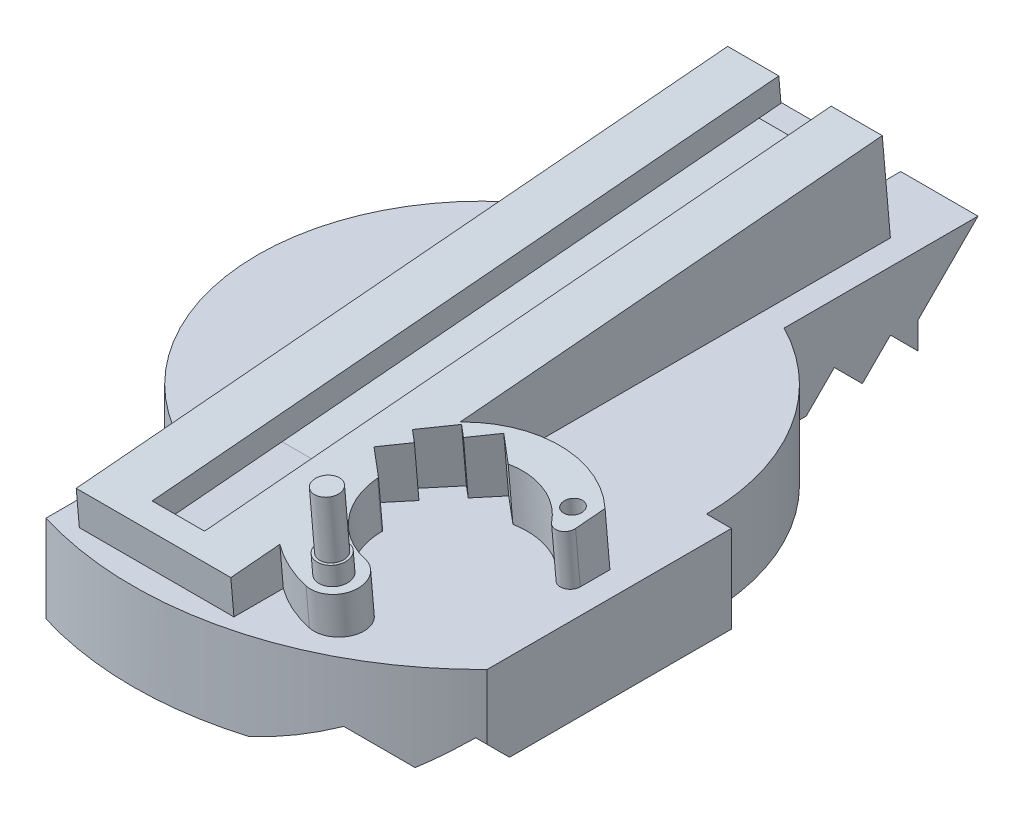
from build123d import *

# Parameters (mm, degrees)
ESQUISSE1_W                     = 100
ESQUISSE1_H                     = 140
ESQUISSE1_R                     = 45
BOSS_EXTRU_1_DEPTH              = 12.5
ESQUISSE3_W                     = 100
ESQUISSE3_H                     = 140
BOSS_EXTRU_2_DEPTH              = 5
BOSS_EXTRU_6_REACH              = 196.163
ESQUISSE15_W                    = 31
ESQUISSE15_H                    = 96
BOSS_EXTRU_3_DEPTH              = 60
BOSS_EXTRU_3_DIRECTION_2_REACH  = 94.681
ESQUISSE7_W                     = 31
ESQUISSE7_H                     = 7.615352471
BOSS_EXTRU_4_DEPTH              = 5
ENL_V_MAT_EXTRU_3_DEPTH         = 126.114159057
CHANFREIN1_SIZE                 = 13
ESQUISSE18_W                    = 5.5
ESQUISSE18_H                    = 3
ENL_V_MAT_EXTRU_5_DEPTH         = 10
CHANFREIN2_SIZE                 = 2
ENL_V_MAT_EXTRU_1_DEPTH         = 89.006477678
ENL_V_MAT_EXTRU_1_DEPTH_BACK    = 89.006477678
ENL_V_MAT_EXTRU_2_DEPTH         = 94.282464894
ENL_V_MAT_EXTRU_2_DEPTH_BACK    = 94.282464894
ESQUISSE17_W                    = 6.4
ESQUISSE17_H                    = 3.4
ENL_V_MAT_EXTRU_4_DEPTH         = 5
CHANFREIN3_SIZE                 = 0.5
ESQUISSE19_OUTSIDE_W            = 131.598
ESQUISSE19_OUTSIDE_H            = 176.598
ENL_V_MAT_EXTRU_6_DEPTH         = 89.006477678
ENL_V_MAT_EXTRU_7_DEPTH         = 10
ENL_V_MAT_EXTRU_7_DEPTH_BACK    = 88.26725067
BOSS_EXTRU_7_REACH              = 92.836
ESQUISSE22_R                    = 1.9
ENL_V_MAT_EXTRU_8_DEPTH         = 10
ESQUISSE23_R                    = 3
BOSS_EXTRU_8_DEPTH              = 3.9
ESQUISSE24_R                    = 2.5
BOSS_EXTRU_9_DEPTH              = 12
BOSS_EXTRU_10_REACH             = 97.553
BOSS_EXTRU_10_DIRECTION_2_REACH = 97.553
ENL_V_MAT_EXTRU_10_DEPTH        = 5
ENL_V_MAT_EXTRU_10_DEPTH_BACK   = 5
ENL_V_MAT_EXTRU_11_REACH        = 153.593
ESQUISSE27_W                    = 2
ESQUISSE27_H                    = 15.461719317
CHANFREIN4_SIZE                 = 1


# Some blends are built 0.0001 mm under size
with BuildPart() as part:
    # Esquisse1 → Boss.-Extru.1 (new body)
    with BuildSketch(Plane(origin=(0, 0, 0), x_dir=(1, 0, 0), z_dir=(0, 1, 0))):
        Rectangle(ESQUISSE1_W, ESQUISSE1_H)
        with Locations(Location((0, 0, 0), (0, 0, 270))):
            Circle(ESQUISSE1_R, mode=Mode.SUBTRACT)
    extrude(amount=BOSS_EXTRU_1_DEPTH)

    # Esquisse3 → Boss.-Extru.2 (add)
    with BuildSketch(Plane(origin=(0, 12.5, 0), x_dir=(1, 0, 0), z_dir=(0, 1, 0))):
        Rectangle(ESQUISSE3_W, ESQUISSE3_H)
    extrude(amount=BOSS_EXTRU_2_DEPTH)

    # Boss.-Extru.6: up to this face of the body (flat: up to its plane)
    boss_extru_6_end = Plane(part.part.faces().sort_by_distance((0, 17.5, 0))[0])
    # Esquisse15 → Boss.-Extru.6 (add, up to the picked face)
    with BuildSketch(Plane(origin=(0, 9.857399497, 117.355323483), x_dir=(1, 0, 0), z_dir=(0, 0.9961946980917459, 0.08715574274765504)), mode=Mode.PRIVATE) as boss_extru_6_sk1:
        with Locations((0, 135.689006627)):
            Rectangle(ESQUISSE15_W, ESQUISSE15_H)
    boss_extru_6_tool1 = split(extrude(boss_extru_6_sk1.sketch, amount=-BOSS_EXTRU_6_REACH, mode=Mode.PRIVATE), bisect_by=boss_extru_6_end, keep=Keep.BOTH, mode=Mode.PRIVATE)
    add(boss_extru_6_tool1.solids().sort_by(Axis((0, 21.683476, -17.817346), (0, -0.9961946980917459, -0.08715574274765504)))[0])

    # Esquisse6 → Boss.-Extru.3 (add)
    with BuildSketch(Plane(origin=(0, -4.423503026, -1.91805798), x_dir=(1, 0, 0), z_dir=(0, -0.08715574274765504, 0.9961946980917459))):
        Polygon((15.5, 24.621919528), (10.5, 24.621919528), (5.25, 29.871919528), (5.25, 34.871919528), (15.5, 34.871919528), align=None)
        Polygon((-5.25, 29.871919528), (-5.25, 34.871919528), (-15.5, 34.871919528), (-15.5, 24.621919528), (-10.5, 24.621919528), align=None)
    extrude(amount=BOSS_EXTRU_3_DEPTH)

    # Boss.-Extru.3 direction 2: up to this face of the body (flat: up to its plane)
    boss_extru_3_direction_2_end = Plane(part.part.faces().sort_by_distance((0, 21.683475652, -66.00069771))[0])
    # Esquisse6 → Boss.-Extru.3 direction 2 (add, up to the picked face)
    with BuildSketch(Plane(origin=(0, -4.423503026, -1.91805798), x_dir=(1, 0, 0), z_dir=(0, -0.08715574274765504, 0.9961946980917459)), mode=Mode.PRIVATE) as boss_extru_3_direction_2_sk1:
        Polygon((15.5, 24.621919528), (10.5, 24.621919528), (5.25, 29.871919528), (5.25, 34.871919528), (15.5, 34.871919528), align=None)
    boss_extru_3_direction_2_tool1 = split(extrude(boss_extru_3_direction_2_sk1.sketch, amount=-BOSS_EXTRU_3_DIRECTION_2_REACH, mode=Mode.PRIVATE), bisect_by=boss_extru_3_direction_2_end, keep=Keep.BOTH, mode=Mode.PRIVATE)
    # Esquisse6 → Boss.-Extru.3 direction 2 (add, up to the picked face)
    with BuildSketch(Plane(origin=(0, -4.423503026, -1.91805798), x_dir=(1, 0, 0), z_dir=(0, -0.08715574274765504, 0.9961946980917459)), mode=Mode.PRIVATE) as boss_extru_3_direction_2_sk2:
        Polygon((-5.25, 29.871919528), (-5.25, 34.871919528), (-15.5, 34.871919528), (-15.5, 24.621919528), (-10.5, 24.621919528), align=None)
    boss_extru_3_direction_2_tool2 = split(extrude(boss_extru_3_direction_2_sk2.sketch, amount=-BOSS_EXTRU_3_DIRECTION_2_REACH, mode=Mode.PRIVATE), bisect_by=boss_extru_3_direction_2_end, keep=Keep.BOTH, mode=Mode.PRIVATE)
    add(boss_extru_3_direction_2_tool1.solids().sort_by(Axis((10.884543, 25.717824, 0.718966), (0, 0.08715574274765504, -0.9961946980917459)))[0])
    add(boss_extru_3_direction_2_tool2.solids().sort_by(Axis((-10.884543, 25.717824, 0.718966), (0, 0.08715574274765504, -0.9961946980917459)))[0])

    # Esquisse7 → Boss.-Extru.4 (add)
    with BuildSketch(Plane(origin=(0, -5.096412404, 58.252260331), x_dir=(1, 0, 0), z_dir=(0, -0.08715574274765515, 0.9961946980917459))):
        with Locations((0, 26.490403264)):
            Rectangle(ESQUISSE7_W, ESQUISSE7_H)
    extrude(amount=BOSS_EXTRU_4_DEPTH)

    # Esquisse16 → Enlèv. mat.-Extru.3 (cut)
    with BuildSketch(Plane(origin=(0, 5.8951608, -67.381996276), x_dir=(-1, 0, 0), z_dir=(0, 0.0871557427476551, -0.9961946980917459))):
        Polygon((-10.5, 20.048079499), (-5.25, 25.298079499), (-5.25, 30.298079499), (5.25, 30.298079499), (5.25, 25.298079499), (10.5, 20.048079499), align=None)
    extrude(amount=-ENL_V_MAT_EXTRU_3_DEPTH, mode=Mode.SUBTRACT)

    # Chanfrein1
    # the kernel refuses this chamfer: 13 mm, written as the material it adds along each edge
    with BuildSketch(Plane(origin=(0, 12.5, 0), x_dir=(0, 0, 1), z_dir=(-1, 0, 0))) as chanfrein1_piece_1_section:
        Polygon((45, -CHANFREIN1_SIZE), (45 - CHANFREIN1_SIZE, 0), (45, 0), align=None)
    chanfrein1_piece_1 = revolve(axis=Axis((0, 12.5, 0), (0, 1, 0)), mode=Mode.PRIVATE)
    chanfrein1_piece_1 = split(chanfrein1_piece_1, bisect_by=Plane(origin=(0, 0, -38.269047207), z_dir=(0, 1, 0)), keep=Keep.TOP, mode=Mode.PRIVATE)
    add(chanfrein1_piece_1)

    # Esquisse18 → Enlèv. mat.-Extru.5 (cut)
    with BuildSketch(Plane(origin=(0, 12.5, 0), x_dir=(-1, 0, 0), z_dir=(0, -1, 0))):
        Rectangle(ESQUISSE18_W, ESQUISSE18_H)
    extrude(amount=-ENL_V_MAT_EXTRU_5_DEPTH, mode=Mode.SUBTRACT)

    # Chanfrein2
    chanfrein2_edges = [part.edges().sort_by_distance(p)[0] for p in [
        (0, 12.5, -1.5),
        (0, 12.5, 1.5),
    ]]
    chamfer(chanfrein2_edges, length=CHANFREIN2_SIZE)

    # Esquisse12 → Enlèv. mat.-Extru.1 (cut, two sides: drawn at the far end of the back side and taken through both)
    with BuildSketch(Plane(origin=(0, 17.5, 0), x_dir=(1, 0, 0), z_dir=(0, 1, 0)).offset(-ENL_V_MAT_EXTRU_1_DEPTH_BACK)):
        with BuildLine():
            Line((-50, 70), (-50, -70))
            Line((-50, -70), (-20.5, -70))
            Line((-20.5, -70), (-20.5, -40.059330998))
            ThreePointArc((-20.5, -40.059330998), (-45, 0), (-20.5, 40.059330998))
            Line((-20.5, 40.059330998), (-20.5, 70))
            Line((-20.5, 70), (-50, 70))
        make_face()
        with BuildLine():
            Line((50, 70), (20.5, 70))
            Line((20.5, 70), (20.5, 40.059330998))
            ThreePointArc((20.5, 40.059330998), (38.389451676, 23.478713764), (45, 0))
            Line((45, 0), (50, 0))
            Line((50, 0), (50, 70))
        make_face()
    extrude(amount=ENL_V_MAT_EXTRU_1_DEPTH + ENL_V_MAT_EXTRU_1_DEPTH_BACK, mode=Mode.SUBTRACT)

    # Esquisse13 → Enlèv. mat.-Extru.2 (cut, two sides: drawn at the far end of the back side and taken through both)
    with BuildSketch(Plane(origin=(0, 0, 0), x_dir=(0, 0, -1), z_dir=(1, 0, 0)).offset(-ENL_V_MAT_EXTRU_2_DEPTH_BACK)):
        Polygon((-55.75, 0), (-50.125, 5.625), (-44.5, 0), align=None)
        Polygon((-67, 0), (-61.375, 5.625), (-55.75, 0), align=None)
        Polygon((55.75, 0), (50.125, 5.625), (44.5, 0), align=None)
        Polygon((67, 0), (55.75, 0), (61.375, 5.625), align=None)
    extrude(amount=ENL_V_MAT_EXTRU_2_DEPTH + ENL_V_MAT_EXTRU_2_DEPTH_BACK, mode=Mode.SUBTRACT)

    # Esquisse17 → Enlèv. mat.-Extru.4 (cut)
    with BuildSketch(Plane(origin=(0, 19.971790504, 1.747305259), x_dir=(1, 0, 0), z_dir=(0, 0.9961946980917459, 0.08715574274765504))):
        with Locations((0, 64.639384555)):
            Rectangle(ESQUISSE17_W, ESQUISSE17_H)
    extrude(amount=-ENL_V_MAT_EXTRU_4_DEPTH, mode=Mode.SUBTRACT)

    # Chanfrein3
    chanfrein3_edges = [part.edges().sort_by_distance(p)[0] for p in [
        (-3.2, 25.605484076, -62.646106923),
        (0, 25.457319313, -60.952575936),
        (3.2, 25.605484076, -62.646106923),
        (0, 25.753648838, -64.339637909),
    ]]
    chamfer(chanfrein3_edges, length=CHANFREIN3_SIZE)

    # Esquisse19 outside → Enlèv. mat.-Extru.6 (cut, through all)
    with BuildSketch(Plane(origin=(0, 17.5, 0), x_dir=(1, 0, 0), z_dir=(0, 1, 0))):
        with Locations((2.5, 0)):
            Rectangle(ESQUISSE19_OUTSIDE_W, ESQUISSE19_OUTSIDE_H)
        with BuildLine():
            Line((20.5, 66.930934552), (-20.5, 66.930934552))
            ThreePointArc((-20.5, 66.930934552), (0, -70), (20.5, 66.930934552))
        make_face(mode=Mode.SUBTRACT)
    extrude(amount=-ENL_V_MAT_EXTRU_6_DEPTH, mode=Mode.SUBTRACT)

    # Esquisse20 → Enlèv. mat.-Extru.7 (cut, two sides: drawn at the far end of the back side and taken through both)
    with BuildSketch(Plane(origin=(0, 19.971790504, 1.747305259), x_dir=(-1, 0, 0), z_dir=(0, -0.9961946980917459, -0.08715574274765504)).offset(-ENL_V_MAT_EXTRU_7_DEPTH_BACK)):
        with BuildLine():
            Line((-27.391860643, -19.597109246), (-22.029549541, -15.097595978))
            Line((-22.029549541, -15.097595978), (-18.333520785, -19.502351526))
            Line((-18.333520785, -19.502351526), (-16.035387456, -17.573988697))
            Line((-16.035387456, -17.573988697), (-11.535874188, -22.936299798))
            Line((-11.535874188, -22.936299798), (-13.834007517, -24.864662627))
            Line((-13.834007517, -24.864662627), (-10.137978762, -29.269418175))
            Line((-10.137978762, -29.269418175), (-15.500289863, -33.768931443))
            ThreePointArc((-15.500289863, -33.768931443), (-41.107644425, -43.181035785), (-27.391860643, -19.597109246))
        make_face()
    extrude(amount=ENL_V_MAT_EXTRU_7_DEPTH + ENL_V_MAT_EXTRU_7_DEPTH_BACK, mode=Mode.SUBTRACT)

    # Boss.-Extru.7: up to this plane
    boss_extru_7_end = Plane(origin=(0, 17.5, 0), z_dir=(0, -1, 0))
    # Esquisse21 → Boss.-Extru.7 (add, up to the surface)
    with BuildSketch(Plane(origin=(0, 30.182786159, 2.640651623), x_dir=(1, 0, 0), z_dir=(0, 0.9961946980917459, 0.08715574274765506)), mode=Mode.PRIVATE) as boss_extru_7_sk1:
        with BuildLine():
            Line((45, -17.766740163), (45, -23.698941557))
            ThreePointArc((45, -23.698941557), (43.651360309, -25.589901564), (41.424270252, -24.930637851))
            ThreePointArc((41.424270252, -24.930637851), (35.151897103, -20.306412891), (27.391570779, -19.596866021))
            Line((27.391570779, -19.596866021), (22.029549541, -15.097595978))
            Line((22.029549541, -15.097595978), (18.333520785, -19.502351526))
            Line((18.333520785, -19.502351526), (16.035387456, -17.573988697))
            Line((16.035387456, -17.573988697), (15.5, -18.21203862))
            Line((15.5, -18.21203862), (15.5, -17.314835875))
            ThreePointArc((15.5, -17.314835875), (30.336978295, -11.862904945), (45, -17.766740163))
        make_face()
    boss_extru_7_tool1 = split(extrude(boss_extru_7_sk1.sketch, amount=-BOSS_EXTRU_7_REACH, mode=Mode.PRIVATE), bisect_by=boss_extru_7_end, keep=Keep.BOTH, mode=Mode.PRIVATE)
    add(boss_extru_7_tool1.solids().sort_by_distance((33.379868, 28.680034, 19.81719))[0])
    # Esquisse21 → Boss.-Extru.7 (add, up to the surface)
    with BuildSketch(Plane(origin=(0, 30.182786159, 2.640651623), x_dir=(1, 0, 0), z_dir=(0, 0.9961946980917459, 0.08715574274765506)), mode=Mode.PRIVATE) as boss_extru_7_sk2:
        with BuildLine():
            Line((10.5, -29.573190063), (15.5, -33.768688219))
            ThreePointArc((15.5, -33.768688219), (18.715242473, -42.966256453), (27.025625699, -48.052569085))
            ThreePointArc((27.025625699, -48.052569085), (30.893678772, -53.971873557), (24.974374301, -57.839926629))
            ThreePointArc((24.974374301, -57.839926629), (16.912185529, -54.572288263), (10.5, -48.693493741))
            Line((10.5, -48.693493741), (10.5, -29.573190063))
        make_face()
    boss_extru_7_tool2 = split(extrude(boss_extru_7_sk2.sketch, amount=-BOSS_EXTRU_7_REACH, mode=Mode.PRIVATE), bisect_by=boss_extru_7_end, keep=Keep.BOTH, mode=Mode.PRIVATE)
    add(boss_extru_7_tool2.solids().sort_by_distance((18.76179, 26.065697, 49.699201))[0])
    # Esquisse21 → Boss.-Extru.7 (add, up to the surface)
    with BuildSketch(Plane(origin=(0, 30.182786159, 2.640651623), x_dir=(1, 0, 0), z_dir=(0, 0.9961946980917459, 0.08715574274765506)), mode=Mode.PRIVATE) as boss_extru_7_sk3:
        with BuildLine():
            Line((13.834007517, -24.864662627), (11.111680089, -22.580358687))
            ThreePointArc((11.111680089, -22.580358687), (10.798049448, -23.122928702), (10.5, -23.674211684))
            Line((10.5, -23.674211684), (10.5, -28.837978064))
            Line((10.5, -28.837978064), (13.834007517, -24.864662627))
        make_face()
    boss_extru_7_tool3 = split(extrude(boss_extru_7_sk3.sketch, amount=-BOSS_EXTRU_7_REACH, mode=Mode.PRIVATE), bisect_by=boss_extru_7_end, keep=Keep.BOTH, mode=Mode.PRIVATE)
    add(boss_extru_7_tool3.solids().sort_by_distance((11.652065, 27.971813, 27.912185))[0])

    # Esquisse22 → Enlèv. mat.-Extru.8 (cut)
    with BuildSketch(Plane(origin=(0, 30.182786159, 2.640651623), x_dir=(1, 0, 0), z_dir=(0, 0.9961946980917459, 0.08715574274765506))):
        with Locations(Location((41.24878317, -20.45483769, 0), (0, 0, 270))):
            Circle(ESQUISSE22_R)
        with Locations(Location((18.75121683, -47.266393199, 0), (0, 0, 270))):
            Circle(ESQUISSE22_R)
    extrude(amount=-ENL_V_MAT_EXTRU_8_DEPTH, mode=Mode.SUBTRACT)

    # Esquisse23 → Boss.-Extru.8 (add)
    with BuildSketch(Plane(origin=(0, 30.182786159, 2.640651623), x_dir=(1, 0, 0), z_dir=(0, 0.9961946980917459, 0.08715574274765506))):
        with Locations(Location((26, -53.274774502, 0), (0, 0, 270))):
            Circle(ESQUISSE23_R)
    extrude(amount=BOSS_EXTRU_8_DEPTH)

    # Esquisse24 → Boss.-Extru.9 (add)
    with BuildSketch(Plane(origin=(0, 34.067945482, 2.980559019), x_dir=(1, 0, 0), z_dir=(0, 0.9961946980917459, 0.08715574274765506))):
        with Locations(Location((26, -53.274774502, 0), (0, 0, 270))):
            Circle(ESQUISSE24_R)
    extrude(amount=BOSS_EXTRU_9_DEPTH)

    # Boss.-Extru.10: up to this face of the body (flat: up to its plane)
    boss_extru_10_end = Plane(part.part.faces().sort_by_distance((20.5, 9.818956663, -53.144597734))[0])
    # Esquisse25 → Boss.-Extru.10 (add, up to the picked face)
    with BuildSketch(Plane(origin=(0, 0, 0), x_dir=(0, 0, -1), z_dir=(1, 0, 0)), mode=Mode.PRIVATE) as boss_extru_10_sk1:
        Polygon((66.930934552, 5.5), (78.930934552, 17.5), (66.930934552, 17.5), align=None)
    boss_extru_10_tool1 = split(extrude(boss_extru_10_sk1.sketch, amount=BOSS_EXTRU_10_REACH, mode=Mode.PRIVATE), bisect_by=boss_extru_10_end, keep=Keep.BOTH, mode=Mode.PRIVATE)
    add(boss_extru_10_tool1.solids().sort_by(Axis((0, 13.5, -70.930935), (1, 0, 0)))[0])

    # Boss.-Extru.10 direction 2: up to this face of the body (flat: up to its plane)
    boss_extru_10_direction_2_end = Plane(part.part.faces().sort_by_distance((-20.5, 9.818956663, -53.144597734))[0])
    # Esquisse25 → Boss.-Extru.10 direction 2 (add, up to the picked face)
    with BuildSketch(Plane(origin=(0, 0, 0), x_dir=(0, 0, -1), z_dir=(1, 0, 0)), mode=Mode.PRIVATE) as boss_extru_10_direction_2_sk1:
        Polygon((66.930934552, 5.5), (78.930934552, 17.5), (66.930934552, 17.5), align=None)
    boss_extru_10_direction_2_tool1 = split(extrude(boss_extru_10_direction_2_sk1.sketch, amount=-BOSS_EXTRU_10_DIRECTION_2_REACH, mode=Mode.PRIVATE), bisect_by=boss_extru_10_direction_2_end, keep=Keep.BOTH, mode=Mode.PRIVATE)
    add(boss_extru_10_direction_2_tool1.solids().sort_by(Axis((0, 13.5, -70.930935), (-1, 0, 0)))[0])

    # Esquisse26 → Enlèv. mat.-Extru.10 (cut, two sides: drawn at the far end of the back side and taken through both)
    with BuildSketch(Plane(origin=(0, 0, 0), x_dir=(0, 0, -1), z_dir=(1, 0, 0)).offset(-ENL_V_MAT_EXTRU_10_DEPTH_BACK)):
        Polygon((66.930934552, 5.5), (78.930934552, 17.5), (66.930934552, 17.5), align=None)
    extrude(amount=ENL_V_MAT_EXTRU_10_DEPTH + ENL_V_MAT_EXTRU_10_DEPTH_BACK, mode=Mode.SUBTRACT)

    # Enlèv. mat.-Extru.11: up to this face of the body (flat: up to its plane)
    enl_v_mat_extru_11_end = Plane(part.part.faces().sort_by_distance((0, 17.246713455, 1.5))[0])
    # Esquisse27 → Enlèv. mat.-Extru.11 (cut, up to the picked face)
    with BuildSketch(Plane(origin=(0, 0, -66.930934552), x_dir=(-1, 0, 0), z_dir=(0, 0, -1)), mode=Mode.PRIVATE) as enl_v_mat_extru_11_sk1:
        with Locations((0, 7.730859659)):
            Rectangle(ESQUISSE27_W, ESQUISSE27_H)
    enl_v_mat_extru_11_tool1 = split(extrude(enl_v_mat_extru_11_sk1.sketch, amount=-ENL_V_MAT_EXTRU_11_REACH, mode=Mode.PRIVATE), bisect_by=enl_v_mat_extru_11_end, keep=Keep.BOTH, mode=Mode.PRIVATE)
    add(enl_v_mat_extru_11_tool1.solids().sort_by(Axis((0, 7.73086, -66.930935), (0, 0, 1)))[0], mode=Mode.SUBTRACT)

    # Chanfrein4
    chanfrein4_edges = [part.edges().sort_by_distance(p)[0] for p in [
        (-1, 15.461719317, -34.215467276),
        (1, 15.461719317, -34.215467276),
    ]]
    chamfer(chanfrein4_edges, length=CHANFREIN4_SIZE - 0.0001)  # a hair under: the kernel refuses the full size


solid = part.part
